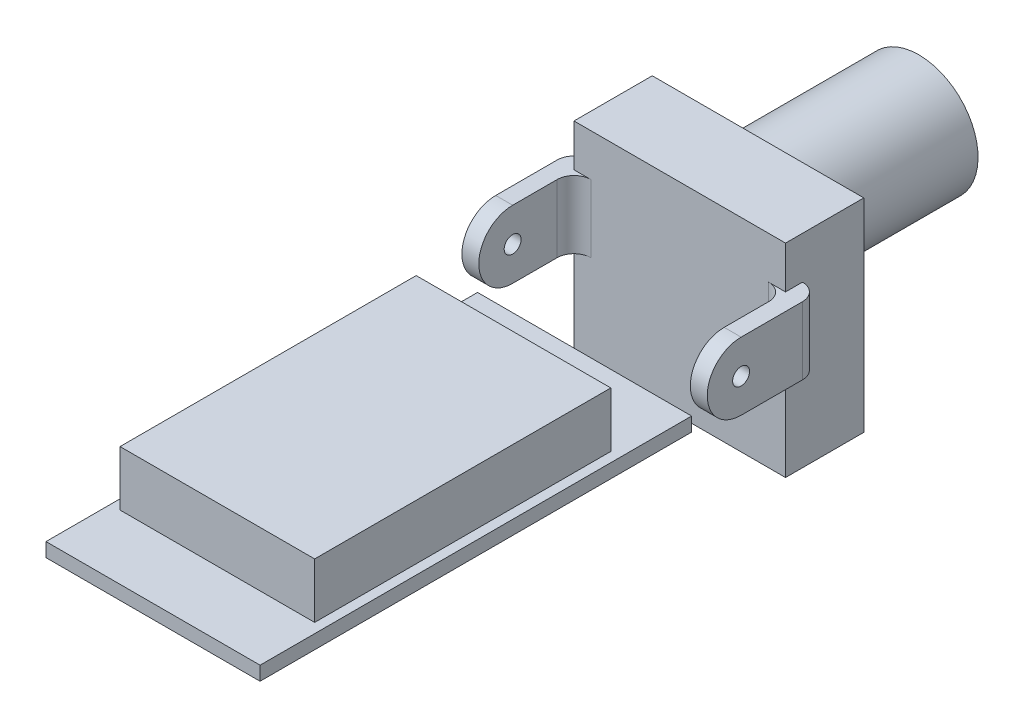
from build123d import *

# Parameters (mm, degrees)
SKETCH1_W           = 25.3
SKETCH1_H           = 51
BOSS_EXTRUDE1_DEPTH = 1.65
SKETCH2_W           = 23
SKETCH2_H           = 35
BOSS_EXTRUDE2_DEPTH = 6.5
BOSS_EXTRUDE3_DEPTH = 12.5
BOSS_EXTRUDE4_START = 12.5
SKETCH3_3_R         = 1
BOSS_EXTRUDE4_DEPTH = 2
BOSS_EXTRUDE5_START = -12.5
SKETCH3_4_R         = 1
BOSS_EXTRUDE5_DEPTH = 2
SKETCH5_W           = 29
SKETCH5_H           = 8
BOSS_EXTRUDE6_DEPTH = 2
FILLET1_R           = 2
SKETCH6_R           = 7
BOSS_EXTRUDE7_DEPTH = 19


with BuildPart() as part:
    # Sketch1 → Boss-Extrude1 (new body)
    with BuildSketch(Plane(origin=(0, 0, 0), x_dir=(1, 0, 0), z_dir=(0, 1, 0))):
        Rectangle(SKETCH1_W, SKETCH1_H)
    extrude(amount=BOSS_EXTRUDE1_DEPTH)

    # Sketch2 → Boss-Extrude2 (add)
    with BuildSketch(Plane(origin=(0, 1.65, 0), x_dir=(1, 0, 0), z_dir=(0, 1, 0))):
        with Locations((0, -0.4)):
            Rectangle(SKETCH2_W, SKETCH2_H)
    extrude(amount=BOSS_EXTRUDE2_DEPTH)


with BuildPart() as body_2:
    # Sketch3 → Boss-Extrude3 (new, symmetric)
    with BuildSketch(Plane(origin=(0, 0, 0), x_dir=(0, 0, -1), z_dir=(1, 0, 0))):
        Polygon((36.75, 13.65), (36.75, 8.65), (36.75, 0.65), (36.75, -10.35), (46, -10.35), (46, 13.65), align=None)
    extrude(amount=BOSS_EXTRUDE3_DEPTH, both=True)



with BuildPart() as body_3:
    # Sketch3<3> → Boss-Extrude4 (new body)
    with BuildSketch(Plane(origin=(0, 0, 0), x_dir=(0, 0, -1), z_dir=(1, 0, 0)).offset(BOSS_EXTRUDE4_START)):
        with BuildLine():
            Line((29.5, 8.65), (36.75, 8.65))
            Line((36.75, 8.65), (36.75, 0.65))
            Line((36.75, 0.65), (29.5, 0.65))
            ThreePointArc((29.5, 0.65), (25.5, 4.65), (29.5, 8.65))
        make_face()
        with Locations((29.5, 4.65)):
            Circle(SKETCH3_3_R, mode=Mode.SUBTRACT)
    extrude(amount=BOSS_EXTRUDE4_DEPTH)


with BuildPart() as body_4:
    # Sketch3<4> → Boss-Extrude5 (new body)
    with BuildSketch(Plane(origin=(0, 0, 0), x_dir=(0, 0, -1), z_dir=(1, 0, 0)).offset(BOSS_EXTRUDE5_START)):
        with BuildLine():
            Line((29.5, 8.65), (36.75, 8.65))
            Line((36.75, 8.65), (36.75, 0.65))
            Line((36.75, 0.65), (29.5, 0.65))
            ThreePointArc((29.5, 0.65), (25.5, 4.65), (29.5, 8.65))
        make_face()
        with Locations((29.5, 4.65)):
            Circle(SKETCH3_4_R, mode=Mode.SUBTRACT)
    extrude(amount=-BOSS_EXTRUDE5_DEPTH)


with BuildPart() as body_2_1:
    add(body_2.part)

    add(body_3.part)  # Boss-Extrude6 merges body 3

    add(body_4.part)  # Boss-Extrude6 merges body 4
    # Sketch5 → Boss-Extrude6 (add)
    with BuildSketch(Plane(origin=(0, 0, -36.75), x_dir=(1, 0, 0), z_dir=(0, 0, -1))):
        with Locations((0, -4.65)):
            Rectangle(SKETCH5_W, SKETCH5_H)
    extrude(amount=BOSS_EXTRUDE6_DEPTH)

    # Fillet1
    fillet1_edges = [body_2_1.edges().sort_by_distance(p)[0] for p in [
        (12.5, 4.65, -36.75),
        (-12.5, 4.65, -36.75),
    ]]
    fillet(fillet1_edges, radius=FILLET1_R)
    fillet1_2_edges = [body_2_1.edges().sort_by_distance(p)[0] for p in [
        (14.5, 4.65, -38.75),
        (-14.5, 4.65, -38.75),
    ]]
    fillet(fillet1_2_edges, radius=FILLET1_R - 0.0001)  # a hair under: the kernel refuses the full size

    # Sketch6 → Boss-Extrude7 (add)
    with BuildSketch(Plane(origin=(0, 0, -46), x_dir=(1, 0, 0), z_dir=(0, 0, -1))):
        with Locations(Location((0, -5.55, 0), (0, 0, 270))):
            Circle(SKETCH6_R)
    extrude(amount=BOSS_EXTRUDE7_DEPTH)


solid = Compound([part.part, body_2_1.part])
